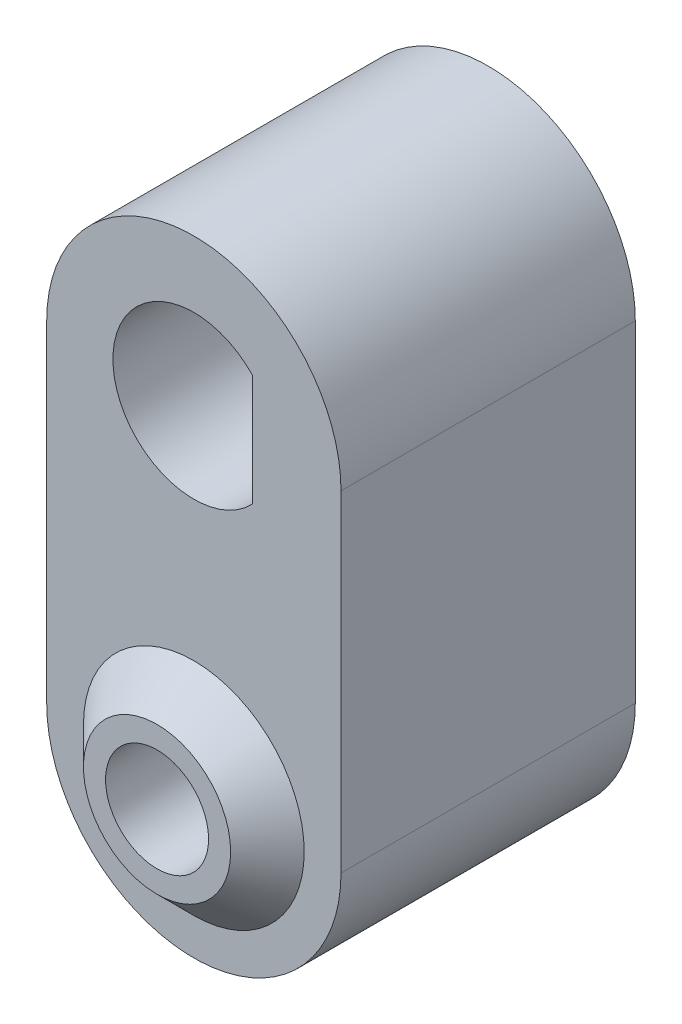
from build123d import *

# Parameters (mm, degrees)
EXTRUDE_2_DEPTH     = 8
SKETCH_1_6_R        = 1.4
CUT_EXTRUDE_2_DEPTH = 8
SKETCH_1_8_R        = 2
SKETCH_1_8_R_2      = 1.4
EXTRUDE_3_DEPTH     = 9
CHAMFER_2_SIZE      = 1


with BuildPart() as part:
    # 草图1 → 凸台-拉伸2 (new body)
    with BuildSketch(Plane.XY):
        with BuildLine():
            Line((4, 0), (4, -9))
            ThreePointArc((4, -9), (0, -13), (-4, -9))
            Line((-4, -9), (-4, 0))
            ThreePointArc((-4, 0), (0, 4), (4, 0))
        make_face()
    extrude(amount=EXTRUDE_2_DEPTH)

    # 草图1<6> → 切除-拉伸2 (cut)
    with BuildSketch(Plane.XY):
        with BuildLine():
            Line((1.6, -1.509966887), (1.6, 1.509966887))
            ThreePointArc((1.6, 1.509966887), (-2.2, 0), (1.6, -1.509966887))
        make_face()
        with Locations((0, -9)):
            Circle(SKETCH_1_6_R)
    extrude(amount=CUT_EXTRUDE_2_DEPTH, mode=Mode.SUBTRACT)

    # 草图1<8> → 凸台-拉伸3 (add)
    with BuildSketch(Plane.XY):
        with Locations((0, -9)):
            Circle(SKETCH_1_8_R)
        with Locations((0, -9)):
            Circle(SKETCH_1_8_R_2, mode=Mode.SUBTRACT)
    extrude(amount=EXTRUDE_3_DEPTH)

    # 倒角2
    chamfer_2_edges = [part.edges().sort_by_distance(p)[0] for p in [
        (-2, -9, 8),
    ]]
    chamfer(chamfer_2_edges, length=CHAMFER_2_SIZE - 0.0001)  # a hair under: the kernel refuses the full size


solid = part.part
